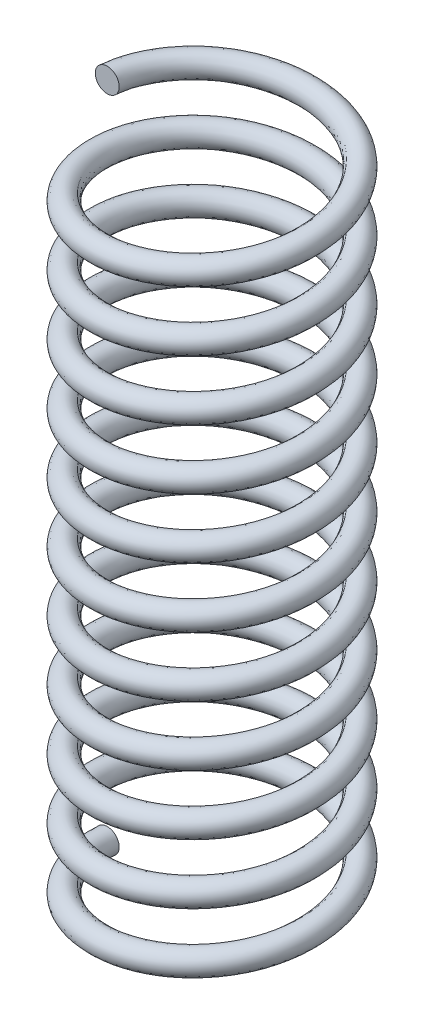
from build123d import *

# Parameters (mm, degrees)
SWEEP1_PITCH       = 2
SWEEP1_HEIGHT      = 22
SWEEP1_RADIUS      = 3.5
SWEEP1_START_ANGLE = -90
SKETCH2_R          = 0.4


with BuildPart() as part:
    # Sweep1: sweep along a helix
    with BuildLine() as sweep1_path:
        add(Helix(SWEEP1_PITCH, SWEEP1_HEIGHT, SWEEP1_RADIUS, center=(0, 0, 0), direction=(0, 1, 0), mode=Mode.PRIVATE).rotate(Axis((0, 0, 0), (0, 1, 0)), SWEEP1_START_ANGLE))
    # Sketch2 → Sweep1 (sweep)
    with BuildSketch(Plane.XY):
        with Locations((-3.5, 0)):
            Circle(SKETCH2_R)
    sweep(path=sweep1_path.line, is_frenet=True)


solid = part.part
